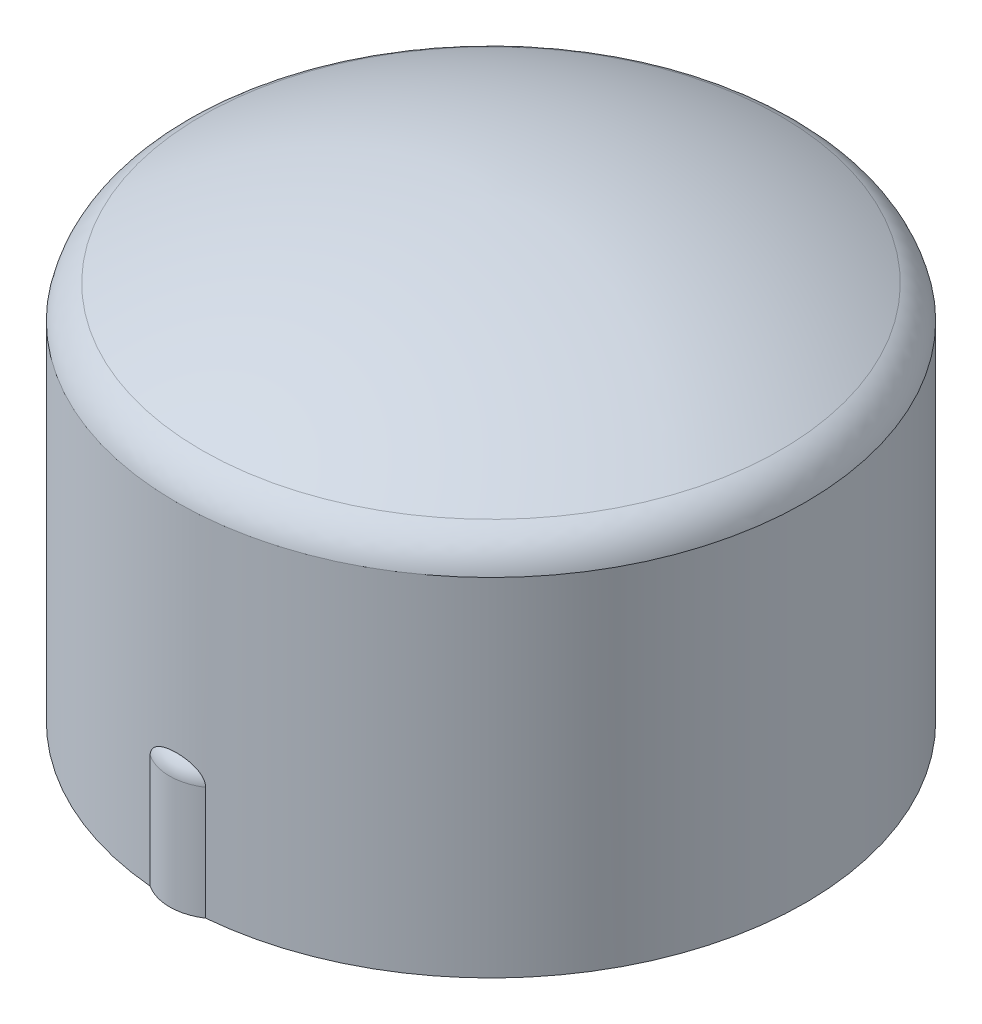
from build123d import *

# Parameters (mm, degrees)
BOSS_EXTRUDE1_DEPTH = 14.986
FILLET1_R           = 2.54
FILLET2_R           = 0.508


with BuildPart() as part:
    # Sketch1 → Revolve1 (revolve)
    with BuildSketch(Plane(origin=(0, 0, 0), x_dir=(0, 0, -1), z_dir=(1, 0, 0)), mode=Mode.PRIVATE) as revolve1_sk:
        with BuildLine():
            Line((-30.226, 0), (-34.544, 0))
            Line((-34.544, 0), (-34.544, 38.1))
            add(Edge.make_bspline(
                [(-34.544, 38.1), (-34.021080338, 40.529206207), (-31.793319074, 41.68897665)],
                knots=[0, 0, 0, 1, 1, 1], degree=2))
            add(Edge.make_bspline(
                [(-31.793319074, 41.68897665), (-17.029892538, 49.760170098), (0, 50.038)],
                knots=[0, 0, 0, 1, 1, 1], degree=2))
            Line((0, 50.038), (0, 44.508100575))
            add(Edge.make_bspline(
                [(-9.398, 42.89990788), (-4.757001601, 44.03505485), (0, 44.508100575)],
                knots=[0, 0, 0, 1, 1, 1], degree=2))
            Line((-9.398, 42.89990788), (-9.398, 45.248349281))
            add(Edge.make_bspline(
                [(-30.226, 38.1), (-23.680294376, 41.89814151), (-16.73762771, 44.280924604), (-9.398, 45.248349281)],
                knots=[0, 0, 0, 0, 0.705520621, 0.705520621, 0.705520621, 0.705520621], degree=3))
            Line((-30.226, 38.1), (-30.226, 0))
        make_face()
    revolve(revolve1_sk.sketch.rotate(Axis((0, 0, 0), (0, 1, 0)), 180), axis=Axis((0, 0, 0), (0, 1, 0)))

    # Sketch2 → Boss-Extrude1 (add)
    with BuildSketch(Plane.XZ):
        with BuildLine():
            ThreePointArc((-3.031237567, 34.410747374), (0.017205772, 35.31933097), (3.064762433, 34.407777714))
            add(Edge.make_bspline(
                [(-3.031237567, 34.410747374), (0.016426392, 33.804246246), (3.064762433, 34.407777714)],
                knots=[0, 0, 0, 1, 1, 1], degree=2))
        make_face()
    extrude(amount=-BOSS_EXTRUDE1_DEPTH)

    # Fillet1
    # the kernel refuses this fillet: 2.54 mm, written as the material it takes off along each edge
    with BuildSketch(Plane(origin=(0.014497608, 14.986, 29.760117923), x_dir=(-0.9885428097510283, 0, -0.15094076086181066), z_dir=(0.15094076086181066, 0, -0.9885428097510283))) as fillet1_piece_1_section:
        with BuildLine():
            CenterArc((5.559213707 - FILLET1_R, -FILLET1_R), FILLET1_R, 0, 90)
            Line((5.559213707 - FILLET1_R, 0), (5.559213707 - FILLET1_R, FILLET1_R * 0.02))
            Line((5.559213707 - FILLET1_R, FILLET1_R * 0.02), (5.559213707 + FILLET1_R * 0.02, FILLET1_R * 0.02))
            Line((5.559213707 + FILLET1_R * 0.02, FILLET1_R * 0.02), (5.559213707 + FILLET1_R * 0.02, -FILLET1_R))
            Line((5.559213707 + FILLET1_R * 0.02, -FILLET1_R), (5.559213707, -FILLET1_R))
        make_face()
    fillet1_piece_1 = revolve(axis=Axis((0.014497608, 14.986, 29.760117923), (0, 1, 0)), revolution_arc=197.418721047, mode=Mode.PRIVATE)
    fillet1_piece_1 = fillet1_piece_1 - Plane(origin=(0, 14.161727142, 0), x_dir=(0, 0, -1), z_dir=(0, 1, 0)) * Cylinder(34.544, 23, mode=Mode.PRIVATE)
    add(fillet1_piece_1, mode=Mode.SUBTRACT)

    # Fillet2
    fillet2_edges = [part.edges().sort_by_distance(p)[0] for p in [
        (0, 0, 30.226),
    ]]
    fillet(fillet2_edges, radius=FILLET2_R)


solid = part.part
